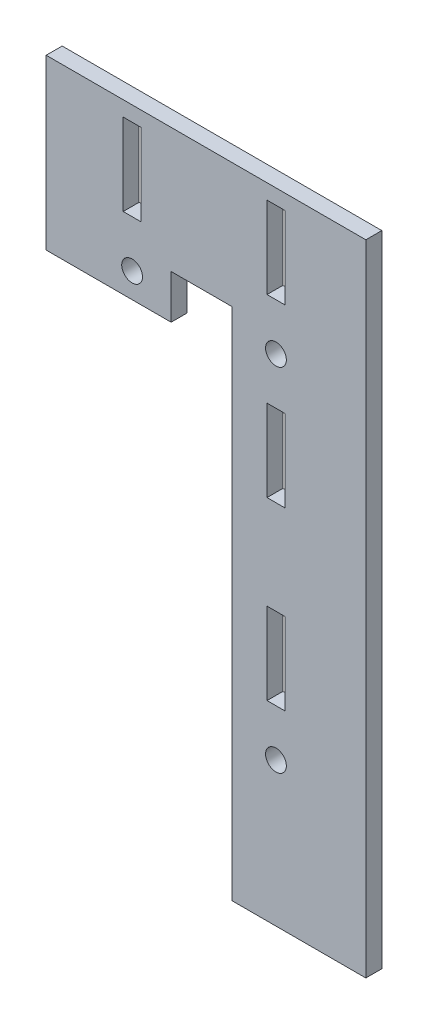
from build123d import *

# Parameters (mm, degrees)
SKETCH1_W           = 101.6
SKETCH1_H           = 50.8
BOSS_EXTRUDE1_DEPTH = 2.54
SKETCH2_R           = 1.651
CUT_EXTRUDE1_DEPTH  = 57.852894385
SKETCH3_W           = 2.83972
SKETCH3_H           = 12.99972
CUT_EXTRUDE4_DEPTH  = 57.852894385
CUT_EXTRUDE5_DEPTH  = 57.852894385


with BuildPart() as part:
    # Sketch1 → Boss-Extrude1 (new body)
    with BuildSketch(Plane(origin=(0, 0, 0), x_dir=(0, 1, 0), z_dir=(0, 0, 1))):
        Rectangle(SKETCH1_W, SKETCH1_H)
    extrude(amount=BOSS_EXTRUDE1_DEPTH)

    # Sketch2 → Cut-Extrude1 (cut, through all)
    with BuildSketch(Plane.XY.offset(2.54)):
        with Locations((11.115903034, 27.94)):
            Circle(SKETCH2_R)
        with Locations((11.115903034, -27.94)):
            Circle(SKETCH2_R)
        with Locations((-11.744096966, 27.94)):
            Circle(SKETCH2_R)
    extrude(amount=-CUT_EXTRUDE1_DEPTH, mode=Mode.SUBTRACT)

    # Sketch3 → Cut-Extrude4 (cut, through all)
    with BuildSketch(Plane.XY.offset(2.54)):
        with Locations((11.115903034, -13.97)):
            Rectangle(SKETCH3_W, SKETCH3_H)
        with Locations((11.115903034, 13.97)):
            Rectangle(SKETCH3_W, SKETCH3_H)
        with Locations((11.115903034, 41.91)):
            Rectangle(SKETCH3_W, SKETCH3_H)
        with Locations((-11.744096966, 41.91)):
            Rectangle(SKETCH3_W, SKETCH3_H)
    extrude(amount=-CUT_EXTRUDE4_DEPTH, mode=Mode.SUBTRACT)

    # Sketch5 → Cut-Extrude5 (cut, through all)
    with BuildSketch(Plane.XY.offset(2.54)):
        Polygon((4.108043034, -50.8), (4.108043034, 30.96514), (-5.543956966, 30.96514), (-5.543956966, 23.98014), (-25.4, 23.98014), (-25.4, -50.8), align=None)
    extrude(amount=-CUT_EXTRUDE5_DEPTH, mode=Mode.SUBTRACT)


solid = part.part
